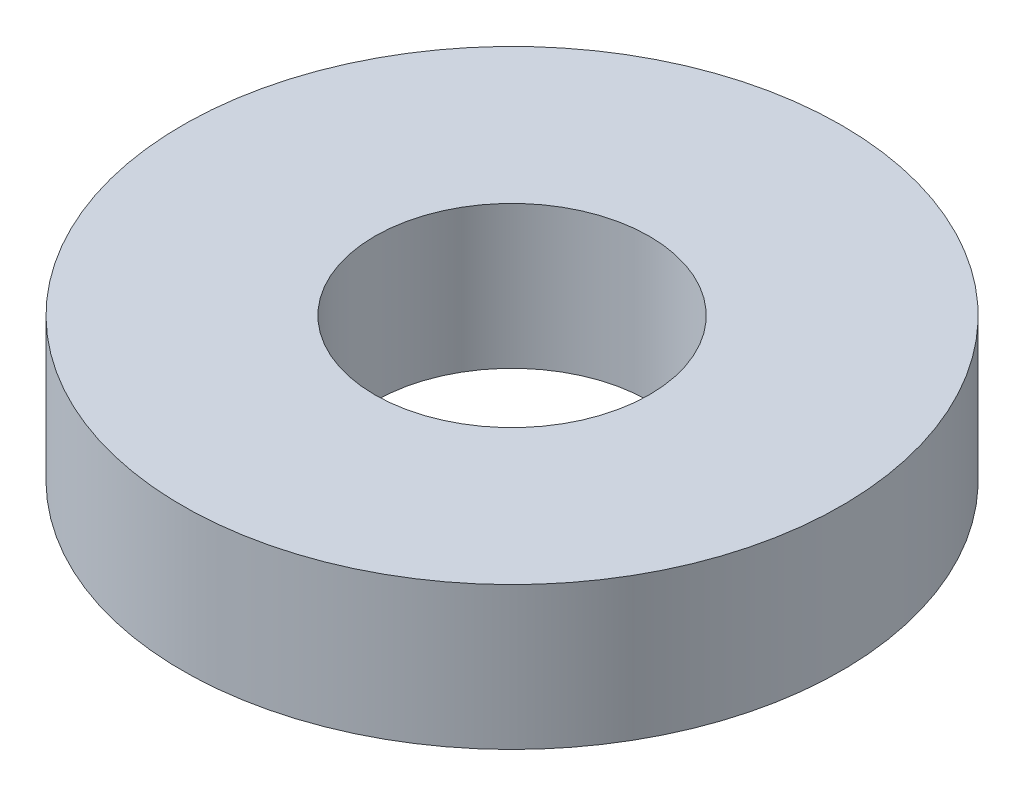
from build123d import *

# Parameters (mm, degrees)
SKETCH1_R           = 30
BOSS_EXTRUDE1_DEPTH = 13
SKETCH2_R           = 12.5
CUT_EXTRUDE1_DEPTH  = 45.373415465


with BuildPart() as part:
    # Sketch1 → Boss-Extrude1 (new body)
    with BuildSketch(Plane(origin=(0, 0, 0), x_dir=(1, 0, 0), z_dir=(0, 1, 0))):
        Circle(SKETCH1_R)
    extrude(amount=BOSS_EXTRUDE1_DEPTH)

    # Sketch2 → Cut-Extrude1 (cut, through all)
    with BuildSketch(Plane(origin=(0, 0, 0), x_dir=(1, 0, 0), z_dir=(0, 1, 0))):
        Circle(SKETCH2_R)
    extrude(amount=CUT_EXTRUDE1_DEPTH, mode=Mode.SUBTRACT)


solid = part.part
